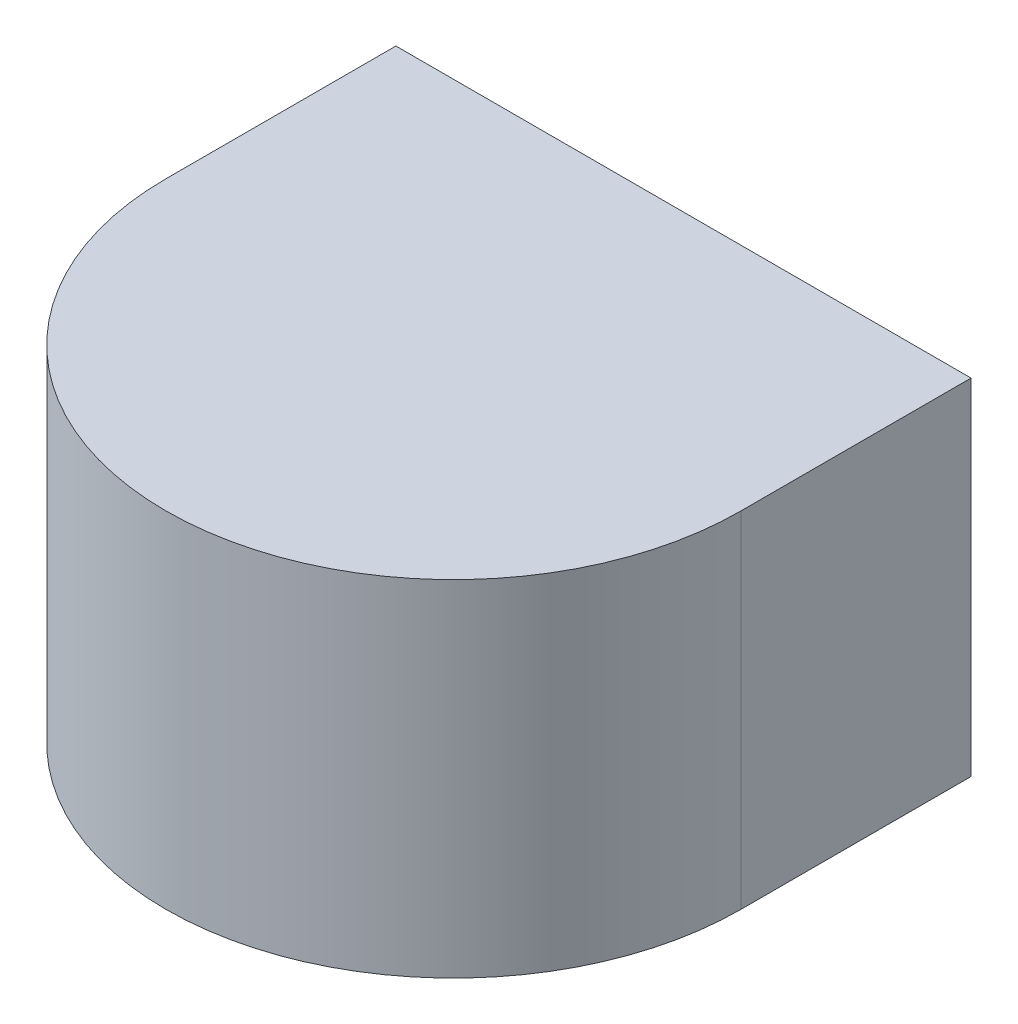
from build123d import *

# Parameters (mm, degrees)
BOSS_EXTRUDE1_DEPTH = 100
BOSS_EXTRUDE2_DEPTH = 50


with BuildPart() as part:
    # Sketch3 → Boss-Extrude1 (new body)
    with BuildSketch(Plane(origin=(0, 0, 0), x_dir=(1, 0, 0), z_dir=(0, 1, 0))):
        with BuildLine():
            Line((-125, 0), (-125, 100))
            Line((-125, 100), (-100, 100))
            Line((-100, 100), (-100, 70))
            Line((-100, 70), (100, 70))
            Line((100, 70), (100, 100))
            Line((100, 100), (125, 100))
            Line((125, 100), (125, 0))
            ThreePointArc((125, 0), (0, -125), (-125, 0))
        make_face()
    extrude(amount=BOSS_EXTRUDE1_DEPTH)

    # Sketch4 → Boss-Extrude2 (add)
    with BuildSketch(Plane(origin=(0, 100, 0), x_dir=(1, 0, 0), z_dir=(0, 1, 0))):
        with BuildLine():
            Line((-100, 100), (100, 100))
            Line((100, 100), (125, 100))
            Line((125, 100), (125, 0))
            ThreePointArc((125, 0), (0, -125), (-125, 0))
            Line((-125, 0), (-125, 100))
            Line((-125, 100), (-100, 100))
        make_face()
    extrude(amount=BOSS_EXTRUDE2_DEPTH)


solid = part.part
